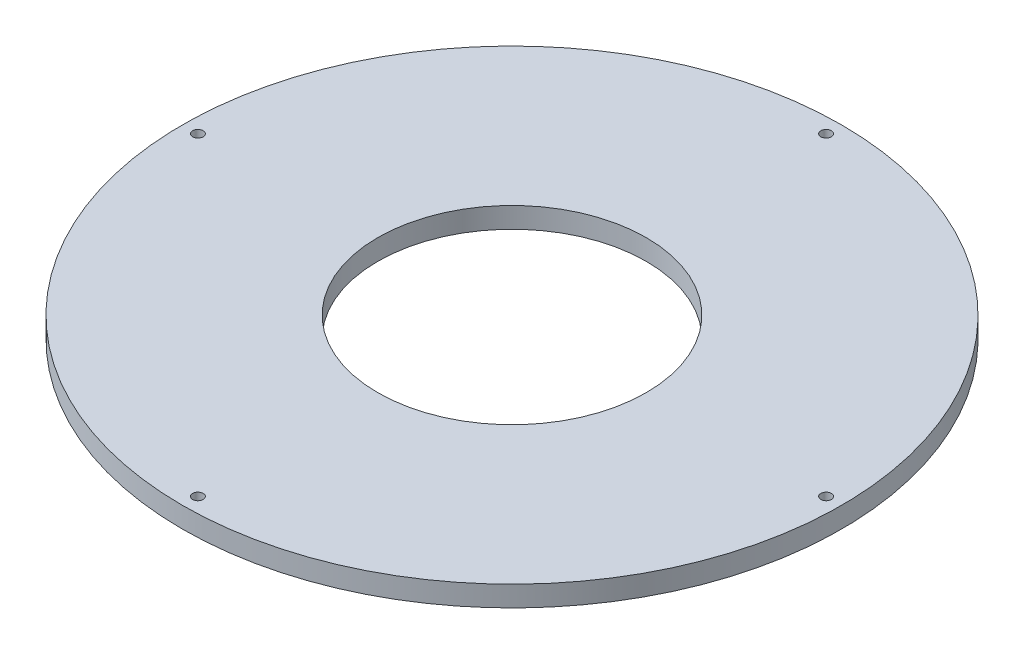
from build123d import *

# Parameters (mm, degrees)
SKETCH1_R             = 101.6
SKETCH1_R_2           = 41.402
BOSS_EXTRUDE1_DEPTH   = 6.35
F_4_CLEARANCE_HOLE1_D = 3.2639


with BuildPart() as part:
    # Sketch1 → Boss-Extrude1 (new body)
    with BuildSketch(Plane(origin=(0, 0, 0), x_dir=(1, 0, 0), z_dir=(0, 1, 0))):
        Circle(SKETCH1_R)
        Circle(SKETCH1_R_2, mode=Mode.SUBTRACT)
    extrude(amount=BOSS_EXTRUDE1_DEPTH)

    # #4 Clearance Hole1 (through all)
    with Locations(Plane(origin=(0, 6.35, 0), x_dir=(1, 0, 0), z_dir=(0, 1, 0))):
        with Locations((0, 96.8375), (96.8375, 0), (0, -96.8375), (-96.8375, 0)):
            Hole(F_4_CLEARANCE_HOLE1_D / 2)


solid = part.part
